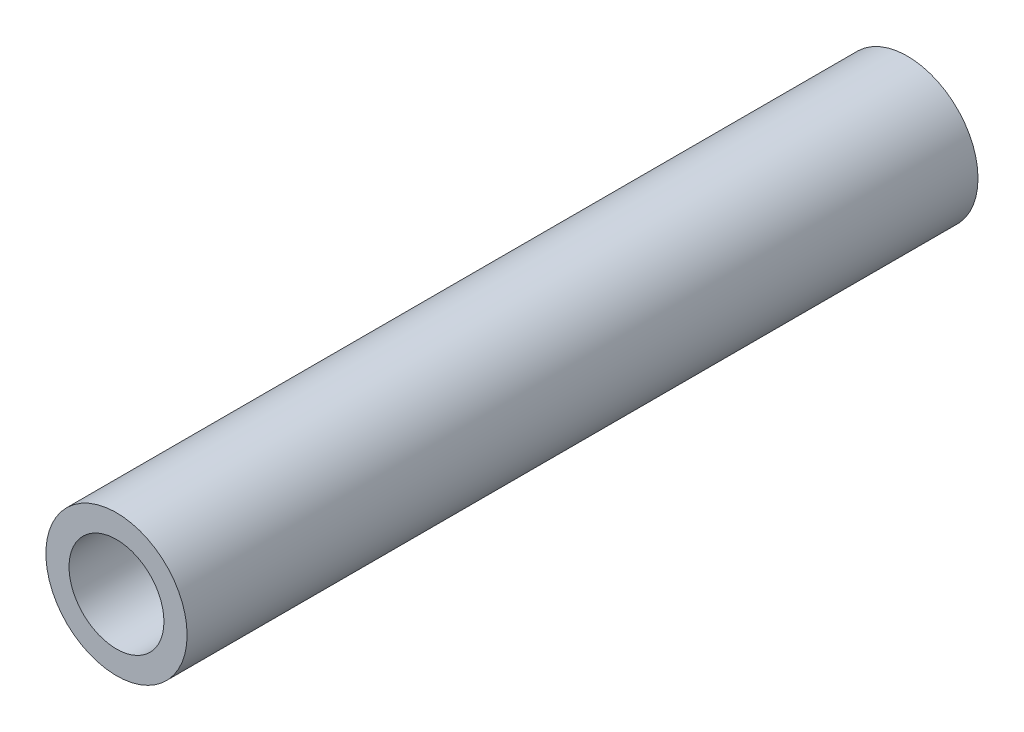
from build123d import *

# Parameters (mm, degrees)
SKETCH_1_R      = 6.25
SKETCH_1_R_2    = 4.2
EXTRUDE_1_DEPTH = 70


with BuildPart() as part:
    # Эскиз1 → Бобышка-Вытянуть1 (new body)
    with BuildSketch(Plane.XY):
        Circle(SKETCH_1_R)
        Circle(SKETCH_1_R_2, mode=Mode.SUBTRACT)
    extrude(amount=EXTRUDE_1_DEPTH)


solid = part.part
